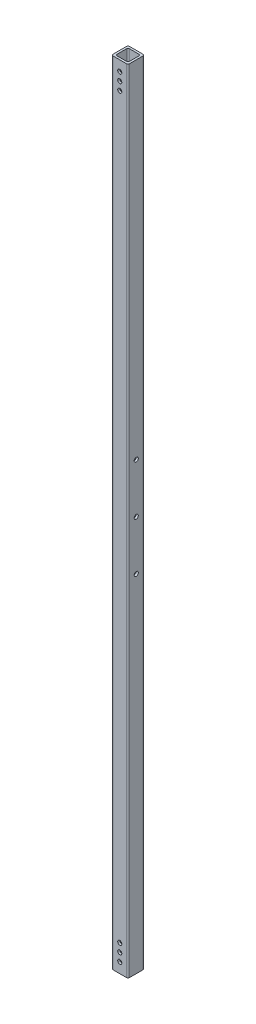
from build123d import *

# Parameters (mm, degrees)
SKETCH1_W           = 25.4
SKETCH1_H           = 25.4
SKETCH1_W_2         = 19.05
SKETCH1_H_2         = 19.05
BOSS_EXTRUDE1_DEPTH = 609.6
FILLET1_R           = 2.1082
SKETCH6_R           = 3.175
CUT_EXTRUDE5_DEPTH  = 611.261099858
SKETCH7_R           = 3.175
CUT_EXTRUDE6_DEPTH  = 611.261099858
SKETCH8_R           = 3.175
CUT_EXTRUDE7_DEPTH  = 611.261099858


with BuildPart() as part:
    # Sketch1 → Boss-Extrude1 (new, symmetric)
    with BuildSketch(Plane(origin=(0, 0, 0), x_dir=(1, 0, 0), z_dir=(0, 1, 0))):
        Rectangle(SKETCH1_W, SKETCH1_H)
        Rectangle(SKETCH1_W_2, SKETCH1_H_2, mode=Mode.SUBTRACT)
    extrude(amount=BOSS_EXTRUDE1_DEPTH, both=True)

    # Fillet1
    fillet1_edges = [part.edges().sort_by_distance(p)[0] for p in [
        (9.525, 0, -9.525),
        (-9.525, 0, -9.525),
        (-9.525, 0, 9.525),
        (9.525, 0, 9.525),
        (12.7, 0, -12.7),
        (-12.7, 0, -12.7),
        (-12.7, 0, 12.7),
        (12.7, 0, 12.7),
    ]]
    fillet(fillet1_edges, radius=FILLET1_R)

    # Sketch6 → Cut-Extrude5 (cut, through all)
    with BuildSketch(Plane(origin=(0, 0, -12.7), x_dir=(-1, 0, 0), z_dir=(0, 0, -1))):
        with Locations((0, 568.325)):
            Circle(SKETCH6_R)
        with Locations((0, 581.025)):
            Circle(SKETCH6_R)
        with Locations((0, 593.725)):
            Circle(SKETCH6_R)
    cut_extrude5 = extrude(amount=-CUT_EXTRUDE5_DEPTH, mode=Mode.SUBTRACT)

    # Sketch7 → Cut-Extrude6 (cut, through all)
    with BuildSketch(Plane.ZY.offset(12.7)):
        Circle(SKETCH7_R)
    extrude(amount=-CUT_EXTRUDE6_DEPTH, mode=Mode.SUBTRACT)

    # Sketch8 → Cut-Extrude7 (cut, through all)
    with BuildSketch(Plane.ZY.offset(12.7)):
        with Locations((0, -76.2)):
            Circle(SKETCH8_R)
    cut_extrude7 = extrude(amount=-CUT_EXTRUDE7_DEPTH, mode=Mode.SUBTRACT)

    # Mirror1: Cut-Extrude7 across plane
    add(cut_extrude7.mirror(Plane.ZX), mode=Mode.SUBTRACT)

    # Mirror2: Cut-Extrude5 across plane
    add(cut_extrude5.mirror(Plane.ZX), mode=Mode.SUBTRACT)


solid = part.part
